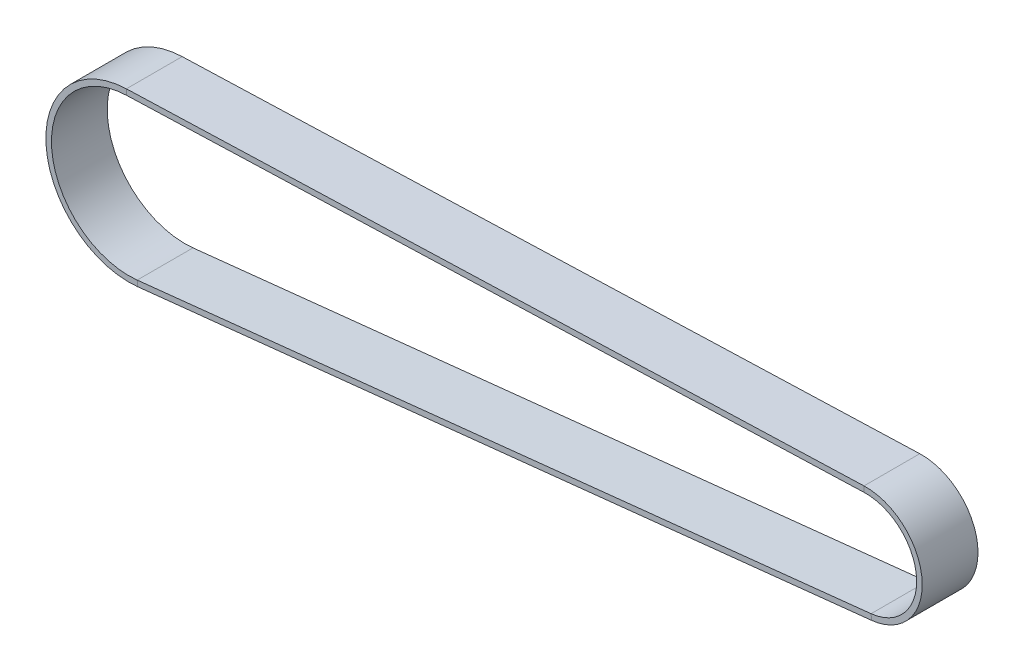
from build123d import *

# Parameters (mm, degrees)
CROQUIS3_W = 10
CROQUIS3_H = 1


with BuildPart() as part:
    # Barrer1: sweep along a path in Croquis2
    with BuildLine(Plane.XY) as barrer1_path:
        Line((0.965224878, -9.078834778), (-130.607144948, -23.067075312))
        ThreePointArc((-130.607144948, -23.067075312), (-145.948280448, -10.210409366), (-132.546701076, 4.657070851))
        Line((-132.546701076, 4.657070851), (-0.308284467, 9.124793734))
        ThreePointArc((-0.308284467, 9.124793734), (9.107739315, 0.637169185), (0.965224878, -9.078834778))
    # Croquis3 → Barrer1 (sweep)
    with BuildSketch(Plane(origin=(-0.308284467, 0, 0), x_dir=(0, 0, -1), z_dir=(1, 0, 0))):
        with Locations((0, 9.624793734)):
            Rectangle(CROQUIS3_W, CROQUIS3_H)
    sweep(path=barrer1_path.line)


solid = part.part
